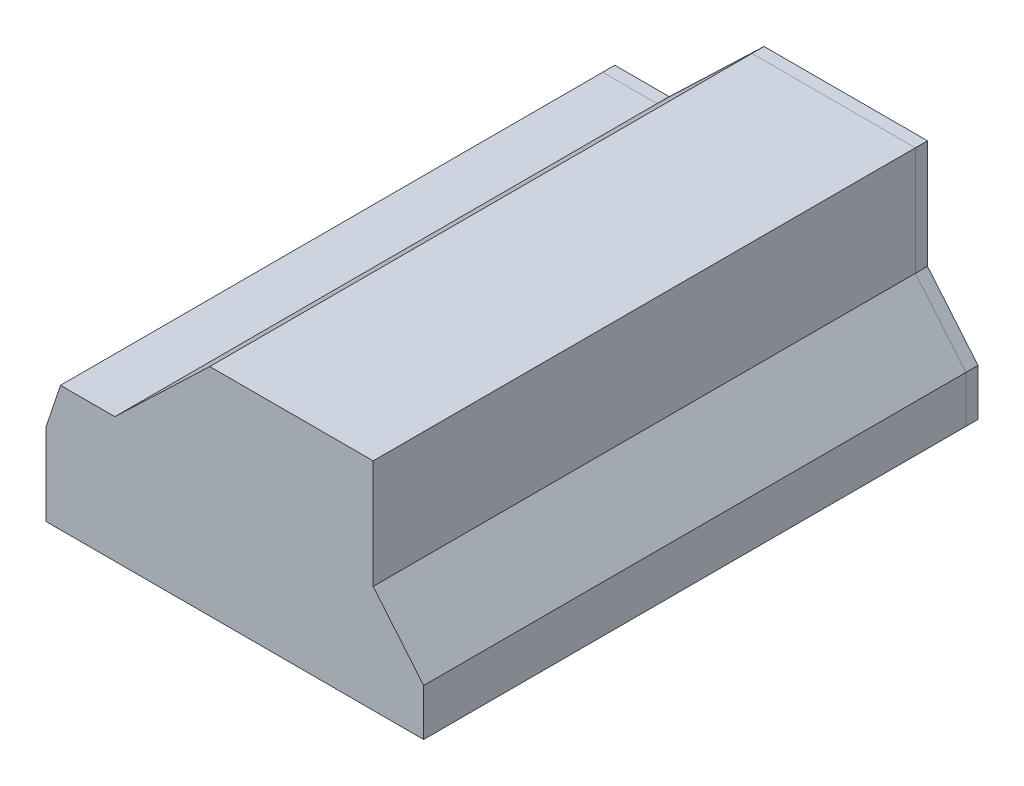
from build123d import *

# Parameters (mm, degrees)
BOSS_EXTRUDE1_DEPTH    = 105
SHELL1_START           = -10
SHELL1_OUTLINE_W       = 18
SHELL1_OUTLINE_H       = 109.8
SHELL1_DEPTH           = 2.4
SHELL1_START_2         = -58.763690343
SHELL1_2_OUTLINE_W     = 42.8
SHELL1_2_OUTLINE_H     = 109.8
SHELL1_2_DEPTH         = 51.163690343
SHELL1_START_3         = -72.4
SHELL1_3_OUTLINE_W     = 24.8
SHELL1_3_OUTLINE_H     = 109.8
SHELL1_3_DEPTH         = 74.8
SHELL1_4_DEPTH         = 105
SHELL1_START_4         = -2.4
SHELL1_5_DEPTH         = 109.8
BOSS_EXTRUDE3_DEPTH    = 15.4
SKETCH5_R              = 1
CUT_EXTRUDE1_DEPTH     = 8.4
SPLIT1_SURFACE_1_BACK  = 140.581
SPLIT1_SURFACE_1_DEPTH = 281.162
SPLIT1_SURFACE_2_BACK  = 140.581
SPLIT1_SURFACE_2_DEPTH = 281.162


with BuildPart() as part:
    # Sketch1 → Boss-Extrude1 (new body)
    with BuildSketch(Plane.XY):
        Polygon((-39, 38), (-57.8, 20), (-67.8, 20), (-70, 13.400019651), (-70, 0), (0, 0), (0, 6), (-10, 18), (-10, 38), align=None)
    extrude(amount=BOSS_EXTRUDE1_DEPTH)

    # Shell1: read off the stored shape, not the designer's step
    # Shell1 outline → Shell1 (add)
    with BuildSketch(Plane.YZ.offset(SHELL1_START)):
        with Locations((31.4, 52.5)):
            Rectangle(SHELL1_OUTLINE_W, SHELL1_OUTLINE_H)
    extrude(amount=SHELL1_DEPTH)

    # Shell1 2 outline → Shell1 2 (add)
    with BuildSketch(Plane.YZ.offset(SHELL1_START_2)):
        with Locations((19, 52.5)):
            Rectangle(SHELL1_2_OUTLINE_W, SHELL1_2_OUTLINE_H)
    extrude(amount=SHELL1_2_DEPTH)

    # Shell1 3 outline → Shell1 3 (add)
    with BuildSketch(Plane.YZ.offset(SHELL1_START_3)):
        with Locations((10, 52.5)):
            Rectangle(SHELL1_3_OUTLINE_W, SHELL1_3_OUTLINE_H)
    extrude(amount=SHELL1_3_DEPTH)

    # Shell1 4 outline → Shell1 4 (cut)
    with BuildSketch(Plane.XY):
        Polygon((-7.6, 22.4), (-7.6, 18.868919844), (2.4, 6.868919844), (2.4, 22.4), align=None)
        Polygon((-72.4, 13.789487135), (-69.529820499, 22.4), (-72.4, 22.4), align=None)
        Polygon((-58.763690343, 22.4), (-39.963690343, 40.4), (-58.763690343, 40.4), align=None)
        Polygon((0, 0), (0, 6), (-10, 18), (-10, 38), (-39, 38), (-57.8, 20), (-67.8, 20), (-70, 13.400019651), (-70, 0), align=None)
    extrude(amount=SHELL1_4_DEPTH, mode=Mode.SUBTRACT)

    # Shell1 5 outline → Shell1 5 (cut)
    with BuildSketch(Plane.XY.offset(SHELL1_START_4)):
        Polygon((-7.6, 22.4), (-7.6, 18.868919844), (2.4, 6.868919844), (2.4, 22.4), align=None)
        Polygon((-72.4, 13.789487135), (-69.529820499, 22.4), (-72.4, 22.4), align=None)
        Polygon((-58.763690343, 22.4), (-39.963690343, 40.4), (-58.763690343, 40.4), align=None)
    extrude(amount=SHELL1_5_DEPTH, mode=Mode.SUBTRACT)

    # Sketch4 → Boss-Extrude3 (add)
    with BuildSketch(Plane(origin=(0, 0, -2.4), x_dir=(-1, 0, 0), z_dir=(0, 0, -1))):
        with BuildLine():
            Line((36.196924714, 36), (36.196924714, 38))
            Line((36.196924714, 38), (39, 38))
            Line((39, 38), (43.177777778, 34))
            Line((43.177777778, 34), (38.196924714, 34))
            ThreePointArc((38.196924714, 34), (36.782711151, 34.585786438), (36.196924714, 36))
        make_face()
        with BuildLine():
            Line((2, 3.27590013), (0, 3.27590013))
            Line((0, 3.27590013), (0, 6))
            Line((0, 6), (4, 10.8))
            Line((4, 10.8), (4, 5.27590013))
            ThreePointArc((4, 5.27590013), (3.414213562, 3.861686567), (2, 3.27590013))
        make_face()
    extrude(amount=-BOSS_EXTRUDE3_DEPTH)

    # Sketch5 → Cut-Extrude1 (cut)
    with BuildSketch(Plane(origin=(0, 0, -2.4), x_dir=(-1, 0, 0), z_dir=(0, 0, -1))):
        with Locations((2, 5.27590013)):
            Circle(SKETCH5_R)
        with Locations((38.196924714, 36)):
            Circle(SKETCH5_R)
    extrude(amount=-CUT_EXTRUDE1_DEPTH, mode=Mode.SUBTRACT)


with BuildPart() as body_2:
    # Split1: the piece behind the surface
    add(part.part)
    # Split1 surface: a surface, the sketch's curves swept straight by 281.162 mm
    with BuildLine(Plane(origin=(0, 0, 0), x_dir=(0, 0, -1), z_dir=(1, 0, 0)).offset(-SPLIT1_SURFACE_1_BACK), mode=Mode.PRIVATE) as split1_surface_1_path:
        Line((0, -2.4), (0, 40.4))
    split1_surface_1 = Shell.extrude(split1_surface_1_path.wire(), (1 * SPLIT1_SURFACE_1_DEPTH, 0 * SPLIT1_SURFACE_1_DEPTH, 0 * SPLIT1_SURFACE_1_DEPTH))
    split(bisect_by=split1_surface_1, keep=Keep.BOTTOM)


with BuildPart() as part_1:
    add(part.part)

    # Split1: split by a surface, the side it looks to stays
    # Split1 surface: a surface, the sketch's curves swept straight by 281.162 mm
    with BuildLine(Plane(origin=(0, 0, 0), x_dir=(0, 0, -1), z_dir=(1, 0, 0)).offset(-SPLIT1_SURFACE_2_BACK), mode=Mode.PRIVATE) as split1_surface_2_path:
        Line((0, -2.4), (0, 40.4))
    split1_surface_2 = Shell.extrude(split1_surface_2_path.wire(), (1 * SPLIT1_SURFACE_2_DEPTH, 0 * SPLIT1_SURFACE_2_DEPTH, 0 * SPLIT1_SURFACE_2_DEPTH))
    split(bisect_by=split1_surface_2, keep=Keep.TOP)


solid = Compound([body_2.part, part_1.part])
